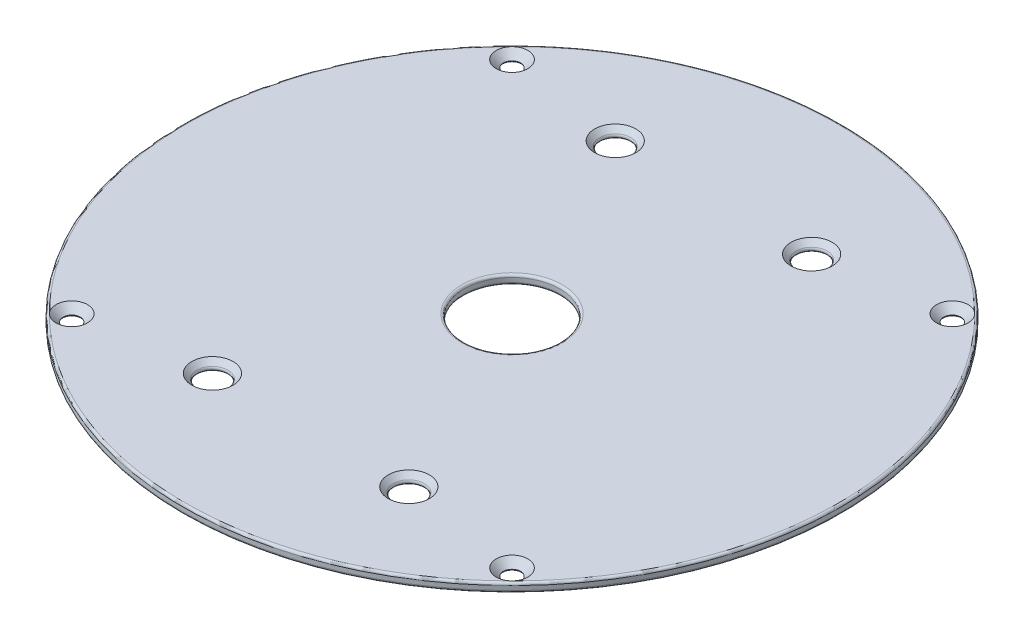
from build123d import *

# Parameters (mm, degrees)
SKETCH1_R           = 68.8
SKETCH1_R_2         = 2.3
SKETCH1_R_3         = 10
SKETCH1_R_4         = 1.8
BOSS_EXTRUDE1_DEPTH = 1.9
CHAMFER1_SIZE       = 2
CHAMFER3_SIZE       = 1.5
FILLET2_R           = 0.5


with BuildPart() as part:
    # Sketch1 → Boss-Extrude1 (new body)
    with BuildSketch(Plane(origin=(0, 0, 0), x_dir=(1, 0, 0), z_dir=(0, 1, 0))):
        with Locations(Location((0, 0, 0), (0, 0, 90))):
            Circle(SKETCH1_R)
        with Locations(Location((-20.5, 42.05, 0), (0, 0, 90))):
            Circle(SKETCH1_R_2, mode=Mode.SUBTRACT)
        with Locations(Location((20.5, 42.05, 0), (0, 0, 90))):
            Circle(SKETCH1_R_2, mode=Mode.SUBTRACT)
        with Locations(Location((20.5, -42.05, 0), (0, 0, 90))):
            Circle(SKETCH1_R_2, mode=Mode.SUBTRACT)
        with Locations(Location((-20.5, -42.05, 0), (0, 0, 90))):
            Circle(SKETCH1_R_2, mode=Mode.SUBTRACT)
        with Locations(Location((0, 0, 0), (0, 0, 90))):
            Circle(SKETCH1_R_3, mode=Mode.SUBTRACT)
        with Locations(Location((-45.961940777, 45.961940777, 0), (0, 0, 90))):
            Circle(SKETCH1_R_4, mode=Mode.SUBTRACT)
        with Locations(Location((45.961940777, 45.961940777, 0), (0, 0, 90))):
            Circle(SKETCH1_R_4, mode=Mode.SUBTRACT)
        with Locations(Location((45.961940777, -45.961940777, 0), (0, 0, 90))):
            Circle(SKETCH1_R_4, mode=Mode.SUBTRACT)
        with Locations(Location((-45.961940777, -45.961940777, 0), (0, 0, 90))):
            Circle(SKETCH1_R_4, mode=Mode.SUBTRACT)
    extrude(amount=BOSS_EXTRUDE1_DEPTH)

    # Chamfer1
    # the kernel refuses this chamfer: 2 mm, written as the material it takes off along each edge
    with BuildSketch(Plane(origin=(-20.5, 1.9, -42.05), x_dir=(0, 0, -1), z_dir=(1, 0, 0))) as chamfer1_piece_1:
        Polygon((2.3, -CHAMFER1_SIZE), (2.3 + CHAMFER1_SIZE, 0), (2.3, 0), align=None)
    revolve(axis=Axis((-20.5, 1.9, -42.05), (0, 1, 0)), mode=Mode.SUBTRACT)
    with BuildSketch(Plane(origin=(20.5, 1.9, -42.05), x_dir=(0, 0, -1), z_dir=(1, 0, 0))) as chamfer1_piece_2:
        Polygon((2.3, -CHAMFER1_SIZE), (2.3 + CHAMFER1_SIZE, 0), (2.3, 0), align=None)
    revolve(axis=Axis((20.5, 1.9, -42.05), (0, 1, 0)), mode=Mode.SUBTRACT)
    with BuildSketch(Plane(origin=(20.5, 1.9, 42.05), x_dir=(0, 0, -1), z_dir=(1, 0, 0))) as chamfer1_piece_3:
        Polygon((2.3, -CHAMFER1_SIZE), (2.3 + CHAMFER1_SIZE, 0), (2.3, 0), align=None)
    revolve(axis=Axis((20.5, 1.9, 42.05), (0, 1, 0)), mode=Mode.SUBTRACT)
    with BuildSketch(Plane(origin=(-20.5, 1.9, 42.05), x_dir=(0, 0, -1), z_dir=(1, 0, 0))) as chamfer1_piece_4:
        Polygon((2.3, -CHAMFER1_SIZE), (2.3 + CHAMFER1_SIZE, 0), (2.3, 0), align=None)
    revolve(axis=Axis((-20.5, 1.9, 42.05), (0, 1, 0)), mode=Mode.SUBTRACT)

    # Chamfer3
    chamfer3_edges = [part.edges().sort_by_distance(p)[0] for p in [
        (-45.961940777, 1.9, 47.761940777),
        (45.961940777, 1.9, 47.761940777),
        (45.961940777, 1.9, -44.161940777),
        (-45.961940777, 1.9, -44.161940777),
    ]]
    chamfer(chamfer3_edges, length=CHAMFER3_SIZE)

    # Fillet2
    # the kernel refuses this fillet: 0.5 mm, written as the material it takes off along each edge
    with BuildSketch(Plane(origin=(0, 0, 0), x_dir=(0, 0, -1), z_dir=(1, 0, 0))) as fillet2_piece_1:
        with BuildLine():
            CenterArc((68.8 - FILLET2_R, FILLET2_R), FILLET2_R, 270, 90)
            Line((68.8 - FILLET2_R, 0), (68.8 - FILLET2_R, -FILLET2_R * 0.02))
            Line((68.8 - FILLET2_R, -FILLET2_R * 0.02), (68.8 + FILLET2_R * 0.02, -FILLET2_R * 0.02))
            Line((68.8 + FILLET2_R * 0.02, -FILLET2_R * 0.02), (68.8 + FILLET2_R * 0.02, FILLET2_R))
            Line((68.8 + FILLET2_R * 0.02, FILLET2_R), (68.8, FILLET2_R))
        make_face()
    revolve(axis=Axis((0, 0, 0), (0, 1, 0)), mode=Mode.SUBTRACT)
    with BuildSketch(Plane(origin=(0, 0, 0), x_dir=(0, 0, -1), z_dir=(1, 0, 0))) as fillet2_piece_2:
        with BuildLine():
            CenterArc((10 + FILLET2_R, FILLET2_R), FILLET2_R, 180, 90)
            Line((10 + FILLET2_R, 0), (10 + FILLET2_R, -FILLET2_R * 0.02))
            Line((10 + FILLET2_R, -FILLET2_R * 0.02), (10 - FILLET2_R * 0.02, -FILLET2_R * 0.02))
            Line((10 - FILLET2_R * 0.02, -FILLET2_R * 0.02), (10 - FILLET2_R * 0.02, FILLET2_R))
            Line((10 - FILLET2_R * 0.02, FILLET2_R), (10, FILLET2_R))
        make_face()
    revolve(axis=Axis((0, 0, 0), (0, 1, 0)), mode=Mode.SUBTRACT)
    with BuildSketch(Plane(origin=(-45.961940777, 0, -45.961940777), x_dir=(0, 0, -1), z_dir=(1, 0, 0))) as fillet2_piece_3:
        with BuildLine():
            CenterArc((2.289897949, 0.5), FILLET2_R, 191.536959033, 78.463040967)
            Line((1.8, 0.4), (1.790202041, 0.398))
            ThreePointArc((1.790202041, 0.398), (1.79, 0.2), (1.79, 0))
            Line((1.79, 0), (1.8, -0.01))
            Line((1.8, -0.01), (2.289897949, -0.01))
            Line((2.289897949, -0.01), (2.289897949, 0))
        make_face()
    revolve(axis=Axis((-45.961940777, 0, -45.961940777), (0, 1, 0)), mode=Mode.SUBTRACT)
    with BuildSketch(Plane(origin=(45.961940777, 0, -45.961940777), x_dir=(0, 0, -1), z_dir=(1, 0, 0))) as fillet2_piece_4:
        with BuildLine():
            CenterArc((2.289897949, 0.5), FILLET2_R, 191.536959033, 78.463040967)
            Line((1.8, 0.4), (1.790202041, 0.398))
            ThreePointArc((1.790202041, 0.398), (1.79, 0.2), (1.79, 0))
            Line((1.79, 0), (1.8, -0.01))
            Line((1.8, -0.01), (2.289897949, -0.01))
            Line((2.289897949, -0.01), (2.289897949, 0))
        make_face()
    revolve(axis=Axis((45.961940777, 0, -45.961940777), (0, 1, 0)), mode=Mode.SUBTRACT)
    with BuildSketch(Plane(origin=(45.961940777, 0, 45.961940777), x_dir=(0, 0, -1), z_dir=(1, 0, 0))) as fillet2_piece_5:
        with BuildLine():
            CenterArc((2.289897949, 0.5), FILLET2_R, 191.536959033, 78.463040967)
            Line((1.8, 0.4), (1.790202041, 0.398))
            ThreePointArc((1.790202041, 0.398), (1.79, 0.2), (1.79, 0))
            Line((1.79, 0), (1.8, -0.01))
            Line((1.8, -0.01), (2.289897949, -0.01))
            Line((2.289897949, -0.01), (2.289897949, 0))
        make_face()
    revolve(axis=Axis((45.961940777, 0, 45.961940777), (0, 1, 0)), mode=Mode.SUBTRACT)
    with BuildSketch(Plane(origin=(-45.961940777, 0, 45.961940777), x_dir=(0, 0, -1), z_dir=(1, 0, 0))) as fillet2_piece_6:
        with BuildLine():
            CenterArc((2.289897949, 0.5), FILLET2_R, 191.536959033, 78.463040967)
            Line((2.289897949, 0), (2.289897949, -0.01))
            Line((2.289897949, -0.01), (1.8, -0.01))
            Line((1.8, -0.01), (1.79, 0))
            ThreePointArc((1.79, 0), (1.79, 0.2), (1.790202041, 0.398))
            Line((1.790202041, 0.398), (1.8, 0.4))
        make_face()
    revolve(axis=Axis((-45.961940777, 0, 45.961940777), (0, 1, 0)), mode=Mode.SUBTRACT)
    with BuildSketch(Plane(origin=(-20.5, 0, 42.05), x_dir=(0, 0, -1), z_dir=(1, 0, 0))) as fillet2_piece_7:
        with BuildLine():
            CenterArc((2.4 + FILLET2_R * 2.41421356237, FILLET2_R), FILLET2_R, 135, 135)
            Line((2.4 + FILLET2_R * 2.41421356237, 0), (2.4 + FILLET2_R * 2.41421356237, -FILLET2_R * 0.02))
            Line((2.4 + FILLET2_R * 2.41421356237, -FILLET2_R * 0.02), (2.4, -FILLET2_R * 0.02))
            Line((2.4, -FILLET2_R * 0.02), (2.4 - FILLET2_R * 0.0141421356237, FILLET2_R * 0.0141421356237))
            Line((2.4 - FILLET2_R * 0.0141421356237, FILLET2_R * 0.0141421356237), (2.4 + FILLET2_R * 1.69296464556, FILLET2_R * 1.72124891681))
            Line((2.4 + FILLET2_R * 1.69296464556, FILLET2_R * 1.72124891681), (2.4 + FILLET2_R * 1.70710678119, FILLET2_R * 1.70710678119))
        make_face()
    revolve(axis=Axis((-20.5, 0, 42.05), (0, 1, 0)), mode=Mode.SUBTRACT)
    with BuildSketch(Plane(origin=(20.5, 0, 42.05), x_dir=(0, 0, -1), z_dir=(1, 0, 0))) as fillet2_piece_8:
        with BuildLine():
            CenterArc((2.4 + FILLET2_R * 2.41421356237, FILLET2_R), FILLET2_R, 135, 135)
            Line((2.4 + FILLET2_R * 2.41421356237, 0), (2.4 + FILLET2_R * 2.41421356237, -FILLET2_R * 0.02))
            Line((2.4 + FILLET2_R * 2.41421356237, -FILLET2_R * 0.02), (2.4, -FILLET2_R * 0.02))
            Line((2.4, -FILLET2_R * 0.02), (2.4 - FILLET2_R * 0.0141421356237, FILLET2_R * 0.0141421356237))
            Line((2.4 - FILLET2_R * 0.0141421356237, FILLET2_R * 0.0141421356237), (2.4 + FILLET2_R * 1.69296464556, FILLET2_R * 1.72124891681))
            Line((2.4 + FILLET2_R * 1.69296464556, FILLET2_R * 1.72124891681), (2.4 + FILLET2_R * 1.70710678119, FILLET2_R * 1.70710678119))
        make_face()
    revolve(axis=Axis((20.5, 0, 42.05), (0, 1, 0)), mode=Mode.SUBTRACT)
    with BuildSketch(Plane(origin=(20.5, 0, -42.05), x_dir=(0, 0, -1), z_dir=(1, 0, 0))) as fillet2_piece_9:
        with BuildLine():
            CenterArc((2.4 + FILLET2_R * 2.41421356237, FILLET2_R), FILLET2_R, 135, 135)
            Line((2.4 + FILLET2_R * 2.41421356237, 0), (2.4 + FILLET2_R * 2.41421356237, -FILLET2_R * 0.02))
            Line((2.4 + FILLET2_R * 2.41421356237, -FILLET2_R * 0.02), (2.4, -FILLET2_R * 0.02))
            Line((2.4, -FILLET2_R * 0.02), (2.4 - FILLET2_R * 0.0141421356237, FILLET2_R * 0.0141421356237))
            Line((2.4 - FILLET2_R * 0.0141421356237, FILLET2_R * 0.0141421356237), (2.4 + FILLET2_R * 1.69296464556, FILLET2_R * 1.72124891681))
            Line((2.4 + FILLET2_R * 1.69296464556, FILLET2_R * 1.72124891681), (2.4 + FILLET2_R * 1.70710678119, FILLET2_R * 1.70710678119))
        make_face()
    revolve(axis=Axis((20.5, 0, -42.05), (0, 1, 0)), mode=Mode.SUBTRACT)
    with BuildSketch(Plane(origin=(-20.5, 0, -42.05), x_dir=(0, 0, -1), z_dir=(1, 0, 0))) as fillet2_piece_10:
        with BuildLine():
            CenterArc((2.4 + FILLET2_R * 2.41421356237, FILLET2_R), FILLET2_R, 135, 135)
            Line((2.4 + FILLET2_R * 2.41421356237, 0), (2.4 + FILLET2_R * 2.41421356237, -FILLET2_R * 0.02))
            Line((2.4 + FILLET2_R * 2.41421356237, -FILLET2_R * 0.02), (2.4, -FILLET2_R * 0.02))
            Line((2.4, -FILLET2_R * 0.02), (2.4 - FILLET2_R * 0.0141421356237, FILLET2_R * 0.0141421356237))
            Line((2.4 - FILLET2_R * 0.0141421356237, FILLET2_R * 0.0141421356237), (2.4 + FILLET2_R * 1.69296464556, FILLET2_R * 1.72124891681))
            Line((2.4 + FILLET2_R * 1.69296464556, FILLET2_R * 1.72124891681), (2.4 + FILLET2_R * 1.70710678119, FILLET2_R * 1.70710678119))
        make_face()
    revolve(axis=Axis((-20.5, 0, -42.05), (0, 1, 0)), mode=Mode.SUBTRACT)
    with BuildSketch(Plane(origin=(0, 1.9, 0), x_dir=(0, 0, -1), z_dir=(1, 0, 0))) as fillet2_piece_11:
        with BuildLine():
            CenterArc((10 + FILLET2_R, -FILLET2_R), FILLET2_R, 90, 90)
            Line((10, -FILLET2_R), (10 - FILLET2_R * 0.02, -FILLET2_R))
            Line((10 - FILLET2_R * 0.02, -FILLET2_R), (10 - FILLET2_R * 0.02, FILLET2_R * 0.02))
            Line((10 - FILLET2_R * 0.02, FILLET2_R * 0.02), (10 + FILLET2_R, FILLET2_R * 0.02))
            Line((10 + FILLET2_R, FILLET2_R * 0.02), (10 + FILLET2_R, 0))
        make_face()
    revolve(axis=Axis((0, 1.9, 0), (0, 1, 0)), mode=Mode.SUBTRACT)
    with BuildSketch(Plane(origin=(0, 1.9, 0), x_dir=(0, 0, -1), z_dir=(1, 0, 0))) as fillet2_piece_12:
        with BuildLine():
            CenterArc((68.8 - FILLET2_R, -FILLET2_R), FILLET2_R, 0, 90)
            Line((68.8, -FILLET2_R), (68.8 + FILLET2_R * 0.02, -FILLET2_R))
            Line((68.8 + FILLET2_R * 0.02, -FILLET2_R), (68.8 + FILLET2_R * 0.02, FILLET2_R * 0.02))
            Line((68.8 + FILLET2_R * 0.02, FILLET2_R * 0.02), (68.8 - FILLET2_R, FILLET2_R * 0.02))
            Line((68.8 - FILLET2_R, FILLET2_R * 0.02), (68.8 - FILLET2_R, 0))
        make_face()
    revolve(axis=Axis((0, 1.9, 0), (0, 1, 0)), mode=Mode.SUBTRACT)


solid = part.part
